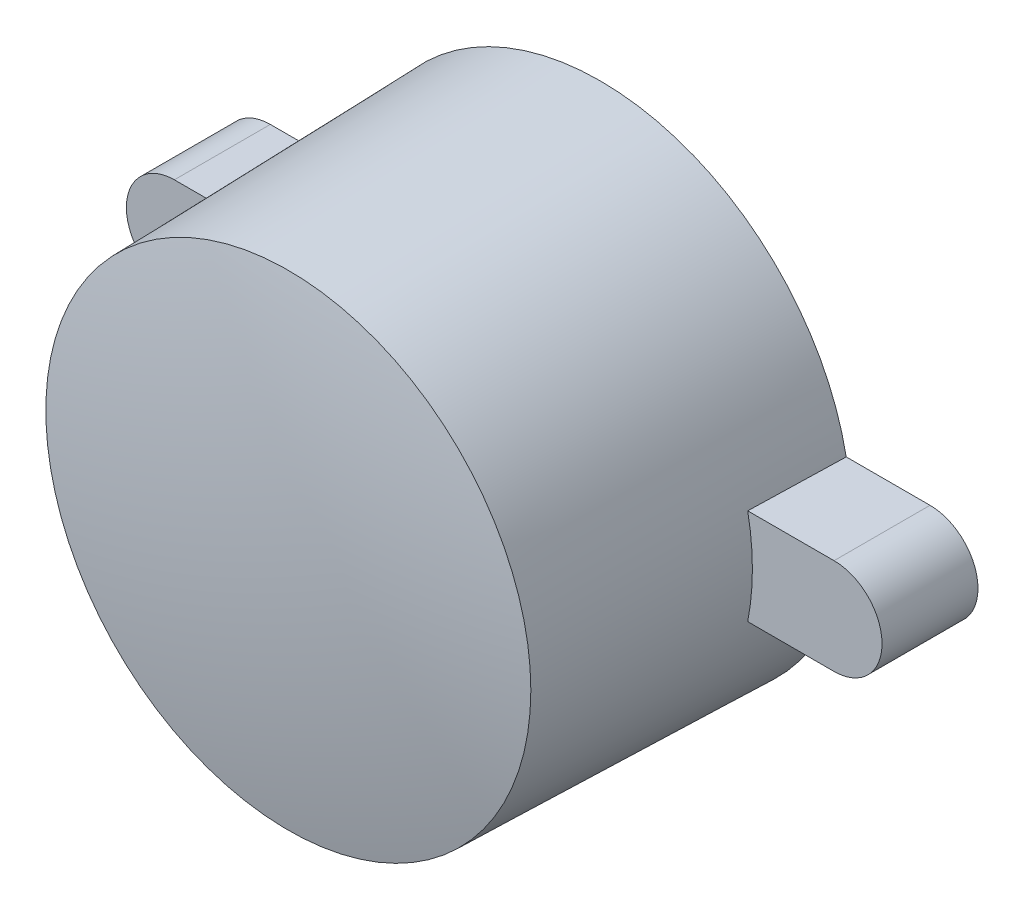
from build123d import *

# Parameters (mm, degrees)
SKETCH1_R           = 5.225
BOSS_EXTRUDE1_DEPTH = 6.5
BOSS_EXTRUDE1_TAPER = 1.5
DOME1_FACE_RADIUS   = 5.05479151
DOME1_HEIGHT        = 0.5
BOSS_EXTRUDE2_DEPTH = 2


# Read off the part's stored shape, not the designer's step: Shell1
with BuildPart() as part:
    # Sketch1 → Boss-Extrude1 (new body)
    with BuildSketch(Plane.XY):
        Circle(SKETCH1_R)
    extrude(amount=BOSS_EXTRUDE1_DEPTH, taper=BOSS_EXTRUDE1_TAPER)

    # Dome1: a dome of height H over a round flat face of radius A is a cap of a sphere of radius (A * A + H * H) / (2 * H)
    dome1_r = (DOME1_FACE_RADIUS * DOME1_FACE_RADIUS + DOME1_HEIGHT * DOME1_HEIGHT) / (2 * DOME1_HEIGHT)
    dome1_base = Plane((0, 0, 6.5), z_dir=(0, 0, 1))
    with Locations(dome1_base.offset(DOME1_HEIGHT - dome1_r)):
        dome1_ball = Sphere(dome1_r, mode=Mode.PRIVATE)
    add(split(dome1_ball, bisect_by=dome1_base, keep=Keep.TOP, mode=Mode.PRIVATE))

    # Shell1 outline → Shell1 (revolve, cut)
    with BuildSketch(Plane.XZ):
        with BuildLine():
            Line((3.474400113, 0), (3.343037716, 5.016528444))
            ThreePointArc((3.343037716, 5.016528444), (1.675590205, 5.191561114), (0, 5.25))
            Line((0, 5.25), (0, 0))
            Line((0, 0), (3.474400113, 0))
        make_face()
    revolve(axis=Axis((0, 0, 0), (0, 0, 1)), mode=Mode.SUBTRACT)

    # Sketch3 → Boss-Extrude2 (add)
    with BuildSketch(Plane(origin=(0, 0, 0), x_dir=(-1, 0, 0), z_dir=(0, 0, -1))):
        with BuildLine():
            Line((-6.875, 1), (-3.327379772, 1))
            ThreePointArc((-3.327379772, 1), (-3.474400113, 0), (-3.327379772, -1))
            Line((-3.327379772, -1), (-6.875, -1))
            ThreePointArc((-6.875, -1), (-7.875, 0), (-6.875, 1))
        make_face()
        with BuildLine():
            Line((3.327379772, 1), (6.875, 1))
            ThreePointArc((6.875, 1), (7.875, 0), (6.875, -1))
            Line((6.875, -1), (3.327379772, -1))
            ThreePointArc((3.327379772, -1), (3.474400113, 0), (3.327379772, 1))
        make_face()
    extrude(amount=-BOSS_EXTRUDE2_DEPTH)


solid = part.part
